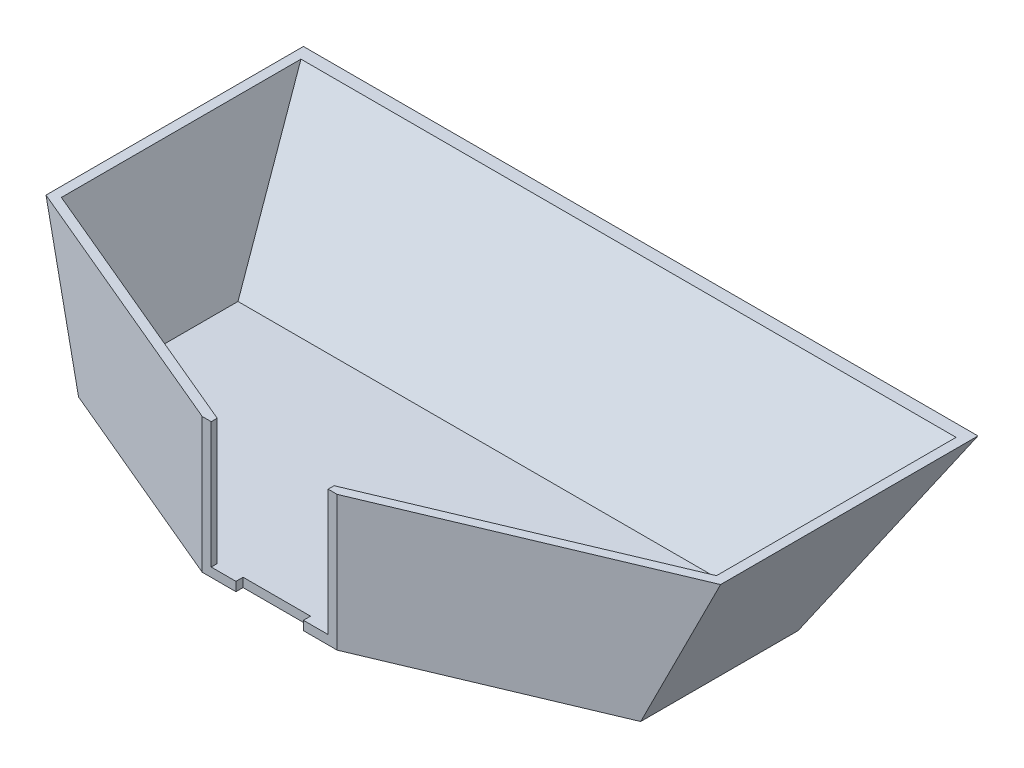
from build123d import *

# Parameters (mm, degrees)
SHELL2_T           = -4
CUT_EXTRUDE1_DEPTH = 3.175


with BuildPart() as part:
    # Sketch2 → Loft2 section 0
    with BuildSketch(Plane(origin=(0, 60, 0), x_dir=(1, 0, 0), z_dir=(0, 1, 0))):
        with BuildLine():
            Line((-150, -24.473684211), (-150, 90))
            Line((-150, 90), (150, 90))
            Line((150, 90), (150, -24.473684211))
            Line((150, -24.473684211), (30, -75))
            Line((30, -75), (-30, -75))
            Line((-30, -75), (-150, -24.473684211))
        make_face()
    # Sketch1 → Loft2 section 1
    with BuildSketch(Plane(origin=(0, 0, 0), x_dir=(1, 0, 0), z_dir=(0, 1, 0))):
        with BuildLine():
            Line((125, -35), (125, 35))
            Line((125, 35), (-125, 35))
            Line((-125, 35), (-125, -35))
            Line((-125, -35), (-30, -75))
            Line((-30, -75), (30, -75))
            Line((30, -75), (125, -35))
        make_face()
    loft()

    # Shell2
    shell2_openings = [part.faces().sort_by_distance(p)[0] for p in [
        (0, 30, 75),
        (0, 60, -16.664896975),
    ]]
    offset(amount=SHELL2_T, openings=shell2_openings, kind=Kind.INTERSECTION)

    # Sketch5 → Cut-Extrude1 (cut)
    with BuildSketch(Plane.XY.offset(75)):
        Polygon((-26, 4), (-15, 4), (-15, 0), (15, 0), (15, 4), (26, 4), (26, 60), (-26, 60), align=None)
    extrude(amount=-CUT_EXTRUDE1_DEPTH, mode=Mode.SUBTRACT)


solid = part.part
